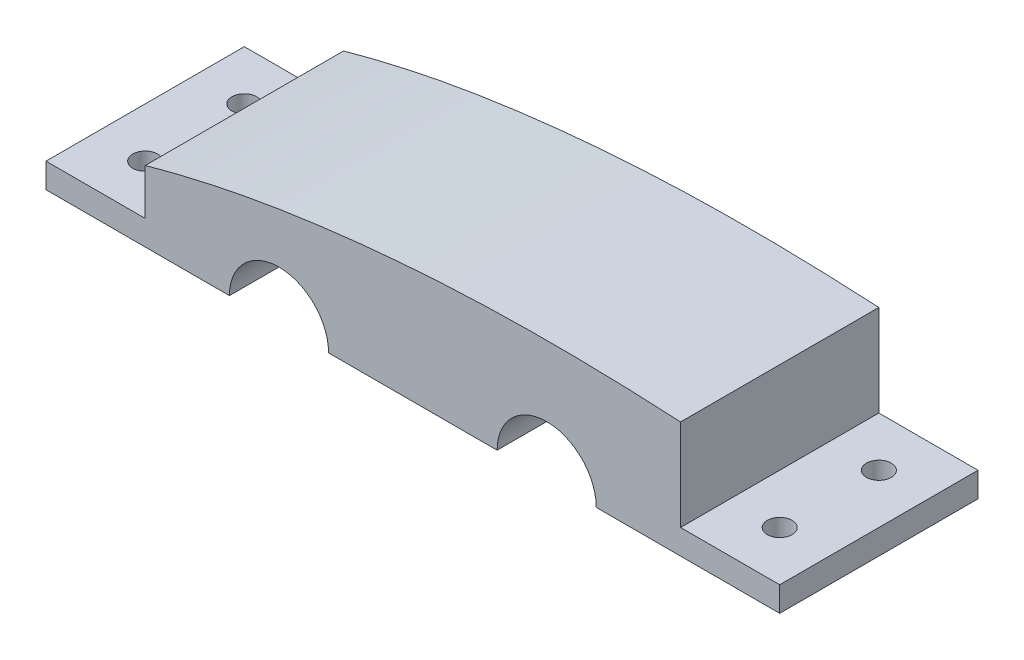
from build123d import *

# Parameters (mm, degrees)
BOSS_EXTRUDE1_DEPTH = 25.4
SKETCH2_R           = 1.5875
CUT_EXTRUDE1_DEPTH  = 55.904554456
SPLIT1_DEPTH        = 25.4
SPLIT1_2_DEPTH      = 25.4


# Read off the part's stored shape, not the designer's step: Split1
with BuildPart() as part:
    # Sketch1 → Boss-Extrude1 (new body)
    with BuildSketch(Plane.XY):
        with BuildLine():
            Line((-10.795, 0), (10.795, 0))
            ThreePointArc((10.795, 0), (17.145, 6.35), (23.495, 0))
            Line((23.495, 0), (46.99, 0))
            Line((46.99, 0), (46.99, 3.175))
            Line((46.99, 3.175), (34.29, 3.175))
            Line((34.29, 3.175), (34.29, 15.875))
            Line((34.29, 15.875), (-34.29, 15.875))
            Line((-34.29, 15.875), (-34.29, 3.175))
            Line((-34.29, 3.175), (-46.99, 3.175))
            Line((-46.99, 3.175), (-46.99, 0))
            Line((-46.99, 0), (-23.495, 0))
            ThreePointArc((-23.495, 0), (-17.145, 6.35), (-10.795, 0))
        make_face()
    extrude(amount=BOSS_EXTRUDE1_DEPTH)

    # Sketch2 → Cut-Extrude1 (cut, through all)
    with BuildSketch(Plane(origin=(0, 3.175, 0), x_dir=(1, 0, 0), z_dir=(0, 1, 0))):
        with Locations(Location((40.64, -6.35, 0), (0, 0, 180))):
            Circle(SKETCH2_R)
        with Locations((40.64, -19.05)):
            Circle(SKETCH2_R)
        with Locations((-40.64, -6.35)):
            Circle(SKETCH2_R)
        with Locations(Location((-40.64, -19.05, 0), (0, 0, 180))):
            Circle(SKETCH2_R)
    extrude(amount=-CUT_EXTRUDE1_DEPTH, mode=Mode.SUBTRACT)

    # Split1 outline → Split1 (cut)
    with BuildSketch(Plane.XY):
        with BuildLine():
            add(Edge.make_bspline(
                [(34.29, 14.886313468), (26.866291946, 15.29633498), (15.604034158, 15.560800445), (0.522525145, 14.87798763), (-10.958660885, 13.761745583), (-22.480305747, 11.986676774), (-30.226096065, 10.175274204), (-34.155574129, 9.077862689), (-34.29, 9.040099193)],
                knots=[0.298916779, 0.298916779, 0.298916779, 0.298916779, 0.346600594, 0.371102737, 0.395726297, 0.420570145, 0.445825119, 0.446720069, 0.446720069, 0.446720069, 0.446720069], degree=3))
            Line((34.29, 14.886313468), (34.29, 15.875))
            Line((34.29, 15.875), (-34.29, 15.875))
            Line((-34.29, 15.875), (-34.29, 9.040099193))
        make_face()
    extrude(amount=SPLIT1_DEPTH, mode=Mode.SUBTRACT)


with BuildPart() as body_2:
    # Split1 2 outline → Split1 2 (new body)
    with BuildSketch(Plane.XY):
        with BuildLine():
            add(Edge.make_bspline(
                [(34.29, 14.886313468), (26.866291946, 15.29633498), (15.604034158, 15.560800445), (0.522525145, 14.87798763), (-10.958660885, 13.761745583), (-22.480305747, 11.986676774), (-30.226096065, 10.175274204), (-34.155574129, 9.077862689), (-34.29, 9.040099193)],
                knots=[0.298916779, 0.298916779, 0.298916779, 0.298916779, 0.346600594, 0.371102737, 0.395726297, 0.420570145, 0.445825119, 0.446720069, 0.446720069, 0.446720069, 0.446720069], degree=3))
            Line((34.29, 14.886313468), (34.29, 15.875))
            Line((34.29, 15.875), (-34.29, 15.875))
            Line((-34.29, 15.875), (-34.29, 9.040099193))
        make_face()
    extrude(amount=SPLIT1_2_DEPTH)


solid = part.part
